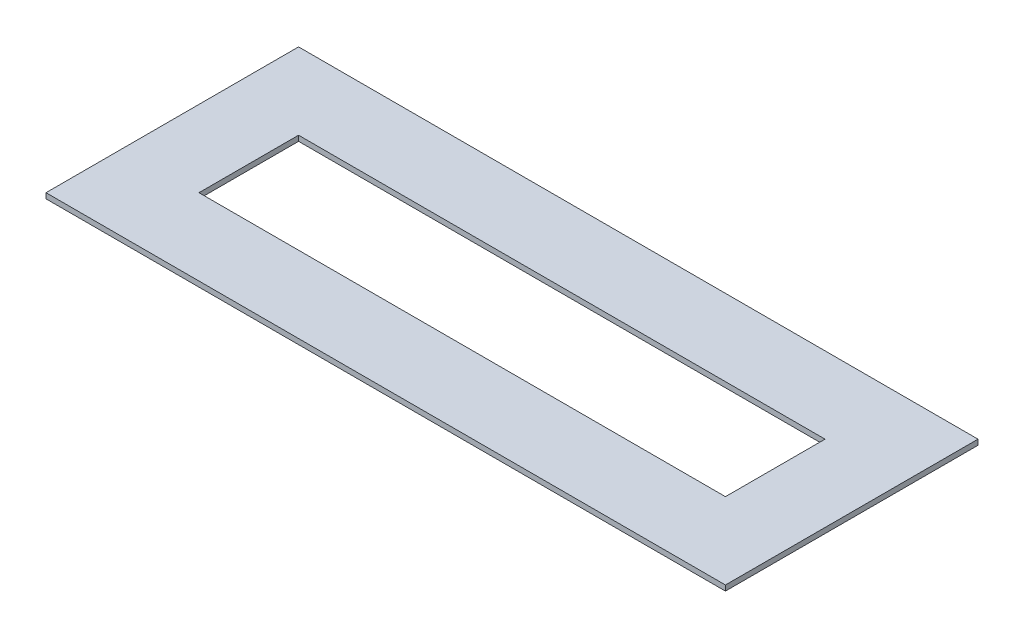
from build123d import *

# Parameters (mm, degrees)
SKETCH1_W           = 606.425
SKETCH1_H           = 225.425
BOSS_EXTRUDE1_DEPTH = 2.38125
SKETCH7_W           = 469.9
SKETCH7_H           = 88.9
CUT_EXTRUDE6_DEPTH  = 324.519101783


with BuildPart() as part:
    # Sketch1 → Boss-Extrude1 (new, symmetric)
    with BuildSketch(Plane(origin=(0, 0, 0), x_dir=(1, 0, 0), z_dir=(0, 1, 0))):
        Rectangle(SKETCH1_W, SKETCH1_H)
    extrude(amount=BOSS_EXTRUDE1_DEPTH, both=True)

    # Sketch7 → Cut-Extrude6 (cut, through all)
    with BuildSketch(Plane(origin=(0, 2.38125, 0), x_dir=(1, 0, 0), z_dir=(0, 1, 0))):
        Rectangle(SKETCH7_W, SKETCH7_H)
    extrude(amount=-CUT_EXTRUDE6_DEPTH, mode=Mode.SUBTRACT)


solid = part.part
